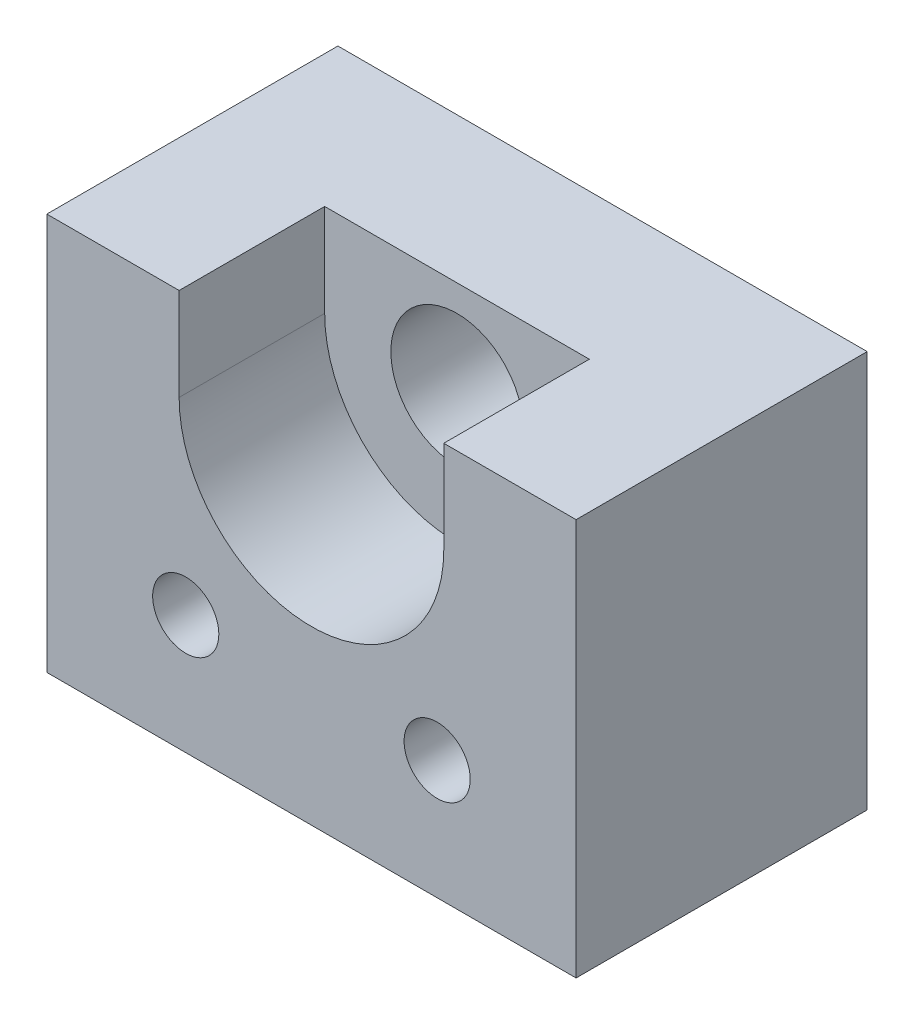
from build123d import *

# Parameters (mm, degrees)
SKETCH1_W           = 20
SKETCH1_H           = 15
SKETCH1_R           = 2.5
SKETCH1_R_2         = 1.25
BOSS_EXTRUDE1_DEPTH = 11
CUT_EXTRUDE1_DEPTH  = 5.5
SKETCH3_W           = 4.8
SKETCH3_H           = 6
BOSS_EXTRUDE2_DEPTH = 5
CHAMFER1_SIZE       = 5


with BuildPart() as part:
    # Sketch1 → Boss-Extrude1 (new body)
    with BuildSketch(Plane.XY):
        with Locations((10, 7.5)):
            Rectangle(SKETCH1_W, SKETCH1_H)
        with Locations((10, 11.5)):
            Circle(SKETCH1_R, mode=Mode.SUBTRACT)
        with Locations((5.25, 4.5)):
            Circle(SKETCH1_R_2, mode=Mode.SUBTRACT)
        with Locations((14.75, 4.5)):
            Circle(SKETCH1_R_2, mode=Mode.SUBTRACT)
    extrude(amount=BOSS_EXTRUDE1_DEPTH)

    # Sketch2 → Cut-Extrude1 (cut)
    with BuildSketch(Plane.XY.offset(11)):
        with BuildLine():
            Line((15, 11.5), (15, 15))
            Line((15, 15), (5, 15))
            Line((5, 15), (5, 11.5))
            ThreePointArc((5, 11.5), (10, 6.5), (15, 11.5))
        make_face()
    extrude(amount=-CUT_EXTRUDE1_DEPTH, mode=Mode.SUBTRACT)

    # Sketch3 → Boss-Extrude2 (add)
    with BuildSketch(Plane(origin=(0, 0, 0), x_dir=(-1, 0, 0), z_dir=(0, 0, -1))):
        with Locations((-10, 3)):
            Rectangle(SKETCH3_W, SKETCH3_H)
    extrude(amount=BOSS_EXTRUDE2_DEPTH)

    # Chamfer1
    chamfer1_edges = [part.edges().sort_by_distance(p)[0] for p in [
        (10, 6, -5),
    ]]
    chamfer(chamfer1_edges, length=CHAMFER1_SIZE - 0.0001)  # a hair under: the kernel refuses the full size


solid = part.part
